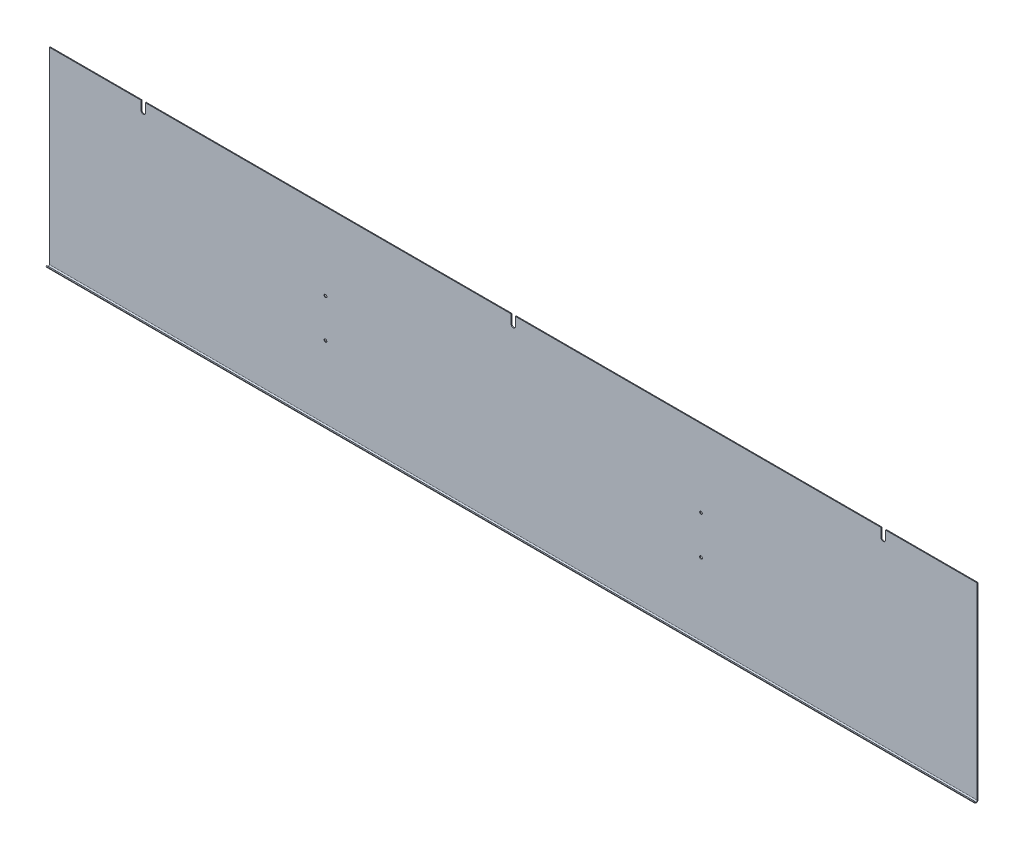
from build123d import *

# Parameters (mm, degrees)
SKETCH1_W            = 1680
SKETCH1_H            = 351
BASE_FLANGE1_DEPTH   = 1.5
EDGE_FLANGE1_START   = -644.471153846
EDGE_FLANGE1_DEPTH   = 1680
EDGE_FLANGE1_2_DEPTH = 1680
SKETCH9_R            = 2.5
CUT_EXTRUDE1_DEPTH   = 10


# Read off the part's stored shape, not the designer's step: Edge-Flange1
# Sheet-metal steps are written as plain solids
with BuildPart() as part:
    # Sketch1 → Base-Flange1 (new body)
    with BuildSketch(Plane.XY):
        with Locations((195.528846154, -50.139423077)):
            Rectangle(SKETCH1_W, SKETCH1_H)
    extrude(amount=-BASE_FLANGE1_DEPTH)

    # Edge-Flange1 outline → Edge-Flange1 (cut)
    with BuildSketch(Plane.YZ.offset(EDGE_FLANGE1_START)):
        with BuildLine():
            ThreePointArc((-215.175321462, -1.5), (-216.795506637, -1.102418412), (-218.047602785, 0))
            Line((-218.047602785, 0), (-225.639423077, 0))
            Line((-225.639423077, 0), (-225.639423077, -1.5))
            Line((-225.639423077, -1.5), (-215.175321462, -1.5))
        make_face()
    extrude(amount=EDGE_FLANGE1_DEPTH, mode=Mode.SUBTRACT)

    # Edge-Flange1 2 outline → Edge-Flange1 2 (add)
    with BuildSketch(Plane.YZ.offset(EDGE_FLANGE1_START)):
        with BuildLine():
            Line((-215.247118232, 6), (-216.925321462, 5.031088913))
            ThreePointArc((-216.925321462, 5.031088913), (-218.591362309, 2.762013733), (-218.047602785, 0))
            Line((-218.047602785, 0), (-215.175321462, 0))
            ThreePointArc((-215.175321462, 0), (-217.107173114, 1.48236191), (-216.175321462, 3.732050808))
            Line((-216.175321462, 3.732050808), (-214.497118232, 4.700961894))
            Line((-214.497118232, 4.700961894), (-215.247118232, 6))
        make_face()
    extrude(amount=EDGE_FLANGE1_2_DEPTH)

    # Sketch9 → Cut-Extrude1 (cut)
    with BuildSketch(Plane.XY):
        with Locations((-144.471153846, -14.639423077)):
            Circle(SKETCH9_R)
        with Locations((-144.471153846, -84.639423077)):
            Circle(SKETCH9_R)
        with Locations((535.528846154, -84.639423077)):
            Circle(SKETCH9_R)
        with Locations((535.528846154, -14.639423077)):
            Circle(SKETCH9_R)
        with BuildLine():
            Line((869.528846154, 125.360576923), (869.528846154, 109.360576923))
            ThreePointArc((869.528846154, 109.360576923), (865.528846154, 105.360576923), (861.528846154, 109.360576923))
            Line((861.528846154, 109.360576923), (861.528846154, 125.360576923))
            ThreePointArc((861.528846154, 125.360576923), (865.528846154, 129.360576923), (869.528846154, 125.360576923))
        make_face()
        with BuildLine():
            Line((199.528846154, 125.360576923), (199.528846154, 109.360576923))
            ThreePointArc((199.528846154, 109.360576923), (195.528846154, 105.360576923), (191.528846154, 109.360576923))
            Line((191.528846154, 109.360576923), (191.528846154, 125.360576923))
            ThreePointArc((191.528846154, 125.360576923), (195.528846154, 129.360576923), (199.528846154, 125.360576923))
        make_face()
        with BuildLine():
            Line((-470.471153846, 125.360576923), (-470.471153846, 109.360576923))
            ThreePointArc((-470.471153846, 109.360576923), (-474.471153846, 105.360576923), (-478.471153846, 109.360576923))
            Line((-478.471153846, 109.360576923), (-478.471153846, 125.360576923))
            ThreePointArc((-478.471153846, 125.360576923), (-474.471153846, 129.360576923), (-470.471153846, 125.360576923))
        make_face()
    extrude(amount=-CUT_EXTRUDE1_DEPTH, mode=Mode.SUBTRACT)


solid = part.part
